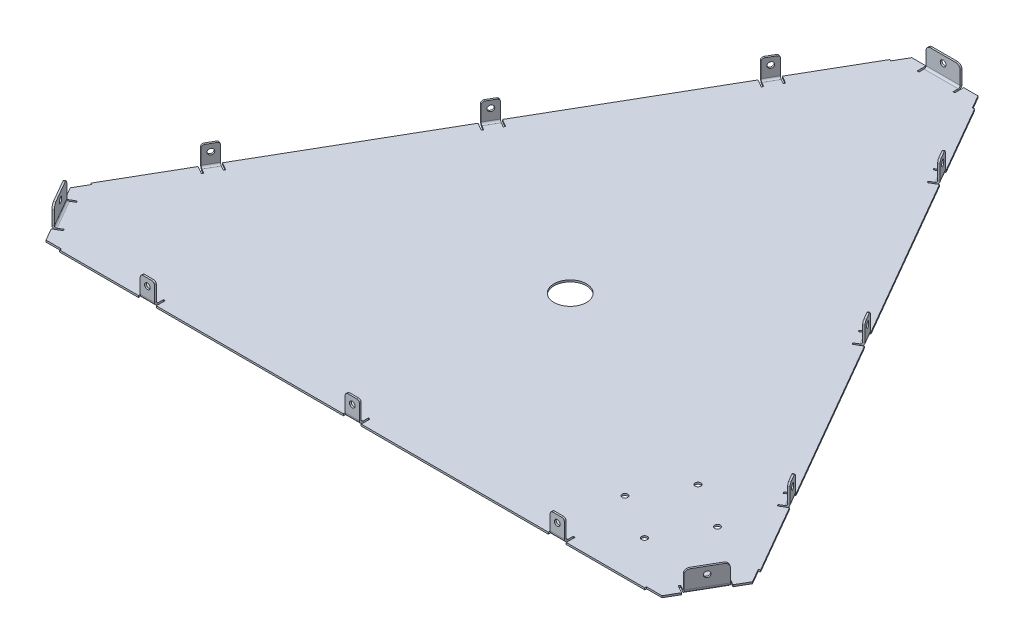
from build123d import *

# Parameters (mm, degrees)
BOSS_EXTRUDE1_DEPTH            = 1
EDGE_FLANGE1_STRIP_W           = 6.2
EDGE_FLANGE1_STRIP_H           = 1
EDGE_FLANGE1_STRIP_CUT_DEPTH   = 19.17
EDGE_FLANGE1_STRIP_2_W         = 6.2
EDGE_FLANGE1_STRIP_2_H         = 1
EDGE_FLANGE1_STRIP_CUT_2_DEPTH = 19.13
EDGE_FLANGE1_STRIP_3_W         = 6.2
EDGE_FLANGE1_STRIP_3_H         = 1
EDGE_FLANGE1_STRIP_CUT_3_DEPTH = 19.13
EDGE_FLANGE1_DEPTH             = 19.17
EDGE_FLANGE1_BEND_DEPTH        = 19.13
EDGE_FLANGE1_BEND_2_DEPTH      = 19.13
FILLET1_R                      = 2.5
EDGE_FLANGE2_STRIP_W           = 6.2
EDGE_FLANGE2_STRIP_H           = 1
EDGE_FLANGE2_STRIP_CUT_DEPTH   = 8
EDGE_FLANGE2_STRIP_2_W         = 6.2
EDGE_FLANGE2_STRIP_2_H         = 1
EDGE_FLANGE2_STRIP_CUT_2_DEPTH = 8
EDGE_FLANGE2_STRIP_3_W         = 6.2
EDGE_FLANGE2_STRIP_3_H         = 1
EDGE_FLANGE2_STRIP_CUT_3_DEPTH = 8
EDGE_FLANGE2_STRIP_4_W         = 6.2
EDGE_FLANGE2_STRIP_4_H         = 1
EDGE_FLANGE2_STRIP_CUT_4_DEPTH = 8
EDGE_FLANGE2_STRIP_5_W         = 6.2
EDGE_FLANGE2_STRIP_5_H         = 1
EDGE_FLANGE2_STRIP_CUT_5_DEPTH = 8
EDGE_FLANGE2_STRIP_6_W         = 6.2
EDGE_FLANGE2_STRIP_6_H         = 1
EDGE_FLANGE2_STRIP_CUT_6_DEPTH = 8
EDGE_FLANGE2_STRIP_7_W         = 6.2
EDGE_FLANGE2_STRIP_7_H         = 1
EDGE_FLANGE2_STRIP_CUT_7_DEPTH = 8
EDGE_FLANGE2_STRIP_8_W         = 6.2
EDGE_FLANGE2_STRIP_8_H         = 1
EDGE_FLANGE2_STRIP_CUT_8_DEPTH = 8
EDGE_FLANGE2_STRIP_9_W         = 6.2
EDGE_FLANGE2_STRIP_9_H         = 1
EDGE_FLANGE2_STRIP_CUT_9_DEPTH = 8
EDGE_FLANGE2_DEPTH             = 8
EDGE_FLANGE2_BEND_DEPTH        = 8
EDGE_FLANGE2_BEND_2_DEPTH      = 8
EDGE_FLANGE2_BEND_3_DEPTH      = 8
EDGE_FLANGE2_BEND_4_DEPTH      = 8
EDGE_FLANGE2_BEND_5_DEPTH      = 8
EDGE_FLANGE2_BEND_6_DEPTH      = 8
EDGE_FLANGE2_BEND_7_DEPTH      = 8
EDGE_FLANGE2_BEND_8_DEPTH      = 8
FILLET2_R                      = 1.5
SKETCH42_R                     = 1.6
CUT_EXTRUDE1_DEPTH             = 1
SKETCH43_R                     = 1.6
CUT_EXTRUDE2_DEPTH             = 1
SKETCH44_R                     = 1.6
CUT_EXTRUDE3_DEPTH             = 1
SKETCH45_R                     = 1.6
CUT_EXTRUDE4_DEPTH             = 10
SKETCH46_R                     = 1.6
CUT_EXTRUDE5_DEPTH             = 10
SKETCH47_R                     = 1.6
CUT_EXTRUDE6_DEPTH             = 10
SKETCH48_R                     = 1.6
SKETCH48_R_2                   = 9.1
CUT_EXTRUDE7_DEPTH             = 10


# Sheet-metal steps are written as plain solids
with BuildPart() as part:
    # Sketch1 → Boss-Extrude1 (new body)
    with BuildSketch(Plane(origin=(0, 0, 0), x_dir=(1, 0, 0), z_dir=(0, 1, 0))):
        Polygon((-2.259810517, 187.062411747), (2.090189483, 194.59683276), (10.090189483, 194.59683276), (10.090189483, 189.59683276), (11.090189483, 189.59683276), (11.090189483, 194.59683276), (30.260189483, 194.59683276), (30.260189483, 189.59683276), (31.260189483, 189.59683276), (31.260189483, 194.59683276), (39.26057424, 194.59683276), (43.61057424, 187.062411747), (44.469773433, 187.558470632), (66.511269353, 149.381479823), (62.181142334, 146.881479823), (62.681142334, 146.01545442), (67.011269353, 148.51545442), (71.011269353, 141.587251189), (66.681142334, 139.087251189), (67.181142334, 138.221225786), (71.511269353, 140.721225786), (124.011269353, 49.788558388), (119.681142334, 47.288558388), (120.181142334, 46.422532984), (124.511269353, 48.922532984), (128.511269353, 41.994329754), (124.181142334, 39.494329754), (124.681142334, 38.62830435), (129.011269353, 41.12830435), (181.511269353, -49.804363047), (177.181142334, -52.304363047), (177.681142334, -53.170388451), (182.011269353, -50.670388451), (186.011269353, -57.598591681), (181.681142334, -60.098591681), (182.181142334, -60.964617085), (186.511269353, -58.464617085), (208.601269353, -96.725619424), (207.735243949, -97.225619424), (212.085243949, -104.760040437), (208.06505157, -111.723217893), (203.734924551, -109.223217893), (203.234924551, -110.089243297), (207.56505157, -112.589243297), (198.00005157, -129.156309272), (193.669924551, -126.656309272), (193.169924551, -127.522334675), (197.50005157, -130.022334675), (193.50005157, -136.950537906), (184.80005157, -136.950537906), (184.80005157, -137.950537906), (140.721610537, -137.950537906), (140.721610537, -132.952033259), (139.721610537, -132.952033259), (139.721610537, -137.950537906), (131.721610537, -137.950537906), (131.721610537, -132.952033259), (130.721610537, -132.952033259), (130.721610537, -137.950537906), (25.721610537, -137.950537906), (25.721610537, -132.952033259), (24.721610537, -132.952033259), (24.721610537, -137.950537906), (16.721610537, -137.950537906), (16.721610537, -132.952033259), (15.721610537, -132.952033259), (15.721610537, -137.950537906), (-89.278389463, -137.950537906), (-89.278389463, -132.952033259), (-90.278389463, -132.952033259), (-90.278389463, -137.950537906), (-98.278389463, -137.950537906), (-98.278389463, -132.952033259), (-99.278389463, -132.952033259), (-99.278389463, -137.950537906), (-143.458389463, -137.950537906), (-143.458389463, -136.950537906), (-152.158389463, -136.950537906), (-156.158389463, -130.022334675), (-151.828262444, -127.522334675), (-152.328262444, -126.656309272), (-156.658389463, -129.156309272), (-166.223389463, -112.589243297), (-161.893262444, -110.089243297), (-162.393262444, -109.223217893), (-166.723389463, -111.723217893), (-170.743581841, -104.760040437), (-166.393581841, -97.225619424), (-167.259607245, -96.725619424), (-145.215835921, -58.5446875), (-140.885708902, -61.0446875), (-140.385708902, -60.178662097), (-144.715835921, -57.678662097), (-140.715835921, -50.750458866), (-136.385708902, -53.250458866), (-135.885708902, -52.384433463), (-140.215835921, -49.884433463), (-87.715835921, 41.048233935), (-83.385708902, 38.548233935), (-82.885708902, 39.414259339), (-87.215835921, 41.914259339), (-83.215835921, 48.842462569), (-78.885708902, 46.342462569), (-78.385708902, 47.208487973), (-82.715835921, 49.708487973), (-30.215835921, 140.64115537), (-25.885708902, 138.14115537), (-25.385708902, 139.007180774), (-29.715835921, 141.507180774), (-25.715835921, 148.435384004), (-21.385708902, 145.935384004), (-20.885708902, 146.801409408), (-25.215835921, 149.301409408), (-3.125835921, 187.562411747), align=None)
    extrude(amount=BOSS_EXTRUDE1_DEPTH)

    # Edge-Flange1 strip (across the edge) → Edge-Flange1 strip cut (cut)
    with BuildSketch(Plane(origin=(30.260189483, 1, -194.59683276), x_dir=(0, 0, 1), z_dir=(-1, 0, 0))):
        with Locations((-1, -0.5)):
            Rectangle(EDGE_FLANGE1_STRIP_W, EDGE_FLANGE1_STRIP_H)
    extrude(amount=EDGE_FLANGE1_STRIP_CUT_DEPTH, mode=Mode.SUBTRACT)

    # Edge-Flange1 strip 2 (across the edge) → Edge-Flange1 strip cut 2 (cut)
    with BuildSketch(Plane(origin=(198.00005157, 1, 129.156309272), x_dir=(-0.866025403784439, 3.491481338843133e-15, -0.4999999999999995), z_dir=(0.4999999999999995, 0, -0.866025403784439))):
        with Locations((-1, -0.5)):
            Rectangle(EDGE_FLANGE1_STRIP_2_W, EDGE_FLANGE1_STRIP_2_H)
    extrude(amount=EDGE_FLANGE1_STRIP_CUT_2_DEPTH, mode=Mode.SUBTRACT)

    # Edge-Flange1 strip 3 (across the edge) → Edge-Flange1 strip cut 3 (cut)
    with BuildSketch(Plane(origin=(-166.223389463, 1, 112.589243297), x_dir=(0.8660254037844379, 3.4914813388431334e-15, -0.5000000000000012), z_dir=(0.5000000000000012, 0, 0.8660254037844379))):
        with Locations((-1, -0.5)):
            Rectangle(EDGE_FLANGE1_STRIP_3_W, EDGE_FLANGE1_STRIP_3_H)
    extrude(amount=EDGE_FLANGE1_STRIP_CUT_3_DEPTH, mode=Mode.SUBTRACT)

    # Edge-Flange1 section (across the edge) → Edge-Flange1 (add)
    with BuildSketch(Plane(origin=(30.260189483, 1, -194.59683276), x_dir=(0, 0, 1), z_dir=(-1, 0, 0))):
        with BuildLine():
            Line((0, 1.1), (0, 11))
            Line((0, 11), (1, 11))
            Line((1, 11), (1, 1.1))
            ThreePointArc((1, 1.1), (1.322182541, 0.322182541), (2.1, 0))
            Line((2.1, 0), (2.1, -1))
            ThreePointArc((2.1, -1), (0.61507576, -0.38492424), (0, 1.1))
        make_face()
    extrude(amount=EDGE_FLANGE1_DEPTH)

    # Edge-Flange1 section 2 (across the edge) → Edge-Flange1 bend (add)
    with BuildSketch(Plane(origin=(198.00005157, 1, 129.156309272), x_dir=(-0.866025403784439, 3.491481338843133e-15, -0.4999999999999995), z_dir=(0.4999999999999995, 0, -0.866025403784439))):
        with BuildLine():
            Line((0, 1.1), (0, 11))
            Line((0, 11), (1, 11))
            Line((1, 11), (1, 1.1))
            ThreePointArc((1, 1.1), (1.322182541, 0.322182541), (2.1, 0))
            Line((2.1, 0), (2.1, -1))
            ThreePointArc((2.1, -1), (0.61507576, -0.38492424), (0, 1.1))
        make_face()
    extrude(amount=EDGE_FLANGE1_BEND_DEPTH)

    # Edge-Flange1 section 3 (across the edge) → Edge-Flange1 bend 2 (add)
    with BuildSketch(Plane(origin=(-166.223389463, 1, 112.589243297), x_dir=(0.8660254037844379, 3.4914813388431334e-15, -0.5000000000000012), z_dir=(0.5000000000000012, 0, 0.8660254037844379))):
        with BuildLine():
            Line((0, 1.1), (0, 11))
            Line((0, 11), (1, 11))
            Line((1, 11), (1, 1.1))
            ThreePointArc((1, 1.1), (1.322182541, 0.322182541), (2.1, 0))
            Line((2.1, 0), (2.1, -1))
            ThreePointArc((2.1, -1), (0.61507576, -0.38492424), (0, 1.1))
        make_face()
    extrude(amount=EDGE_FLANGE1_BEND_2_DEPTH)

    # Fillet1
    fillet1_edges = [part.edges().sort_by_distance(p)[0] for p in [
        (30.260189483, 12, -194.09683276),
        (11.090189483, 12, -194.09683276),
        (197.567038868, 12, 128.906309272),
        (207.132038868, 12, 112.339243297),
        (-165.790376761, 12, 112.339243297),
        (-156.225376761, 12, 128.906309272),
    ]]
    fillet(fillet1_edges, radius=FILLET1_R)

    # Edge-Flange2 strip (across the edge) → Edge-Flange2 strip cut (cut)
    with BuildSketch(Plane(origin=(-98.278389463, 1, 137.950537906), x_dir=(0, 0, -1), z_dir=(1, 0, 0))):
        with Locations((-1, -0.5)):
            Rectangle(EDGE_FLANGE2_STRIP_W, EDGE_FLANGE2_STRIP_H)
    extrude(amount=EDGE_FLANGE2_STRIP_CUT_DEPTH, mode=Mode.SUBTRACT)

    # Edge-Flange2 strip 2 (across the edge) → Edge-Flange2 strip cut 2 (cut)
    with BuildSketch(Plane(origin=(16.721610537, 1, 137.950537906), x_dir=(0, 0, -1), z_dir=(1, 0, 0))):
        with Locations((-1, -0.5)):
            Rectangle(EDGE_FLANGE2_STRIP_2_W, EDGE_FLANGE2_STRIP_2_H)
    extrude(amount=EDGE_FLANGE2_STRIP_CUT_2_DEPTH, mode=Mode.SUBTRACT)

    # Edge-Flange2 strip 3 (across the edge) → Edge-Flange2 strip cut 3 (cut)
    with BuildSketch(Plane(origin=(131.721610537, 1, 137.950537906), x_dir=(0, 0, -1), z_dir=(1, 0, 0))):
        with Locations((-1, -0.5)):
            Rectangle(EDGE_FLANGE2_STRIP_3_W, EDGE_FLANGE2_STRIP_3_H)
    extrude(amount=EDGE_FLANGE2_STRIP_CUT_3_DEPTH, mode=Mode.SUBTRACT)

    # Edge-Flange2 strip 4 (across the edge) → Edge-Flange2 strip cut 4 (cut)
    with BuildSketch(Plane(origin=(186.011269353, 1, 57.598591681), x_dir=(-0.8660254037844403, 3.4914813388431334e-15, 0.4999999999999975), z_dir=(-0.4999999999999975, 0, -0.8660254037844403))):
        with Locations((-1, -0.5)):
            Rectangle(EDGE_FLANGE2_STRIP_4_W, EDGE_FLANGE2_STRIP_4_H)
    extrude(amount=EDGE_FLANGE2_STRIP_CUT_4_DEPTH, mode=Mode.SUBTRACT)

    # Edge-Flange2 strip 5 (across the edge) → Edge-Flange2 strip cut 5 (cut)
    with BuildSketch(Plane(origin=(128.511269353, 1, -41.994329754), x_dir=(-0.8660254037844394, 3.5155183724229278e-15, 0.4999999999999987), z_dir=(-0.4999999999999987, 0, -0.8660254037844394))):
        with Locations((-1, -0.5)):
            Rectangle(EDGE_FLANGE2_STRIP_5_W, EDGE_FLANGE2_STRIP_5_H)
    extrude(amount=EDGE_FLANGE2_STRIP_CUT_5_DEPTH, mode=Mode.SUBTRACT)

    # Edge-Flange2 strip 6 (across the edge) → Edge-Flange2 strip cut 6 (cut)
    with BuildSketch(Plane(origin=(71.011269353, 1, -141.587251189), x_dir=(-0.8660254037844404, 3.4914813388431334e-15, 0.4999999999999973), z_dir=(-0.4999999999999973, 0, -0.8660254037844404))):
        with Locations((-1, -0.5)):
            Rectangle(EDGE_FLANGE2_STRIP_6_W, EDGE_FLANGE2_STRIP_6_H)
    extrude(amount=EDGE_FLANGE2_STRIP_CUT_6_DEPTH, mode=Mode.SUBTRACT)

    # Edge-Flange2 strip 7 (across the edge) → Edge-Flange2 strip cut 7 (cut)
    with BuildSketch(Plane(origin=(-25.715835921, 1, -148.435384004), x_dir=(0.8660254037844387, 3.491481338843133e-15, 0.5000000000000001), z_dir=(-0.5000000000000001, 0, 0.8660254037844387))):
        with Locations((-1, -0.5)):
            Rectangle(EDGE_FLANGE2_STRIP_7_W, EDGE_FLANGE2_STRIP_7_H)
    extrude(amount=EDGE_FLANGE2_STRIP_CUT_7_DEPTH, mode=Mode.SUBTRACT)

    # Edge-Flange2 strip 8 (across the edge) → Edge-Flange2 strip cut 8 (cut)
    with BuildSketch(Plane(origin=(-83.215835921, 1, -48.842462569), x_dir=(0.8660254037844392, 3.4914813388431334e-15, 0.4999999999999991), z_dir=(-0.4999999999999991, 0, 0.8660254037844392))):
        with Locations((-1, -0.5)):
            Rectangle(EDGE_FLANGE2_STRIP_8_W, EDGE_FLANGE2_STRIP_8_H)
    extrude(amount=EDGE_FLANGE2_STRIP_CUT_8_DEPTH, mode=Mode.SUBTRACT)

    # Edge-Flange2 strip 9 (across the edge) → Edge-Flange2 strip cut 9 (cut)
    with BuildSketch(Plane(origin=(-140.715835921, 1, 50.750458866), x_dir=(0.8660254037844387, 3.4914813388431334e-15, 0.5000000000000001), z_dir=(-0.5000000000000001, 0, 0.8660254037844387))):
        with Locations((-1, -0.5)):
            Rectangle(EDGE_FLANGE2_STRIP_9_W, EDGE_FLANGE2_STRIP_9_H)
    extrude(amount=EDGE_FLANGE2_STRIP_CUT_9_DEPTH, mode=Mode.SUBTRACT)

    # Edge-Flange2 section (across the edge) → Edge-Flange2 (add)
    with BuildSketch(Plane(origin=(-98.278389463, 1, 137.950537906), x_dir=(0, 0, -1), z_dir=(1, 0, 0))):
        with BuildLine():
            Line((0, 1.1), (0, 11))
            Line((0, 11), (1, 11))
            Line((1, 11), (1, 1.1))
            ThreePointArc((1, 1.1), (1.322182541, 0.322182541), (2.1, 0))
            Line((2.1, 0), (2.1, -1))
            ThreePointArc((2.1, -1), (0.61507576, -0.38492424), (0, 1.1))
        make_face()
    extrude(amount=EDGE_FLANGE2_DEPTH)

    # Edge-Flange2 section 2 (across the edge) → Edge-Flange2 bend (add)
    with BuildSketch(Plane(origin=(16.721610537, 1, 137.950537906), x_dir=(0, 0, -1), z_dir=(1, 0, 0))):
        with BuildLine():
            Line((0, 1.1), (0, 11))
            Line((0, 11), (1, 11))
            Line((1, 11), (1, 1.1))
            ThreePointArc((1, 1.1), (1.322182541, 0.322182541), (2.1, 0))
            Line((2.1, 0), (2.1, -1))
            ThreePointArc((2.1, -1), (0.61507576, -0.38492424), (0, 1.1))
        make_face()
    extrude(amount=EDGE_FLANGE2_BEND_DEPTH)

    # Edge-Flange2 section 3 (across the edge) → Edge-Flange2 bend 2 (add)
    with BuildSketch(Plane(origin=(131.721610537, 1, 137.950537906), x_dir=(0, 0, -1), z_dir=(1, 0, 0))):
        with BuildLine():
            Line((0, 1.1), (0, 11))
            Line((0, 11), (1, 11))
            Line((1, 11), (1, 1.1))
            ThreePointArc((1, 1.1), (1.322182541, 0.322182541), (2.1, 0))
            Line((2.1, 0), (2.1, -1))
            ThreePointArc((2.1, -1), (0.61507576, -0.38492424), (0, 1.1))
        make_face()
    extrude(amount=EDGE_FLANGE2_BEND_2_DEPTH)

    # Edge-Flange2 section 4 (across the edge) → Edge-Flange2 bend 3 (add)
    with BuildSketch(Plane(origin=(186.011269353, 1, 57.598591681), x_dir=(-0.8660254037844403, 3.4914813388431334e-15, 0.4999999999999975), z_dir=(-0.4999999999999975, 0, -0.8660254037844403))):
        with BuildLine():
            Line((0, 1.1), (0, 11))
            Line((0, 11), (1, 11))
            Line((1, 11), (1, 1.1))
            ThreePointArc((1, 1.1), (1.322182541, 0.322182541), (2.1, 0))
            Line((2.1, 0), (2.1, -1))
            ThreePointArc((2.1, -1), (0.61507576, -0.38492424), (0, 1.1))
        make_face()
    extrude(amount=EDGE_FLANGE2_BEND_3_DEPTH)

    # Edge-Flange2 section 5 (across the edge) → Edge-Flange2 bend 4 (add)
    with BuildSketch(Plane(origin=(128.511269353, 1, -41.994329754), x_dir=(-0.8660254037844394, 3.5155183724229278e-15, 0.4999999999999987), z_dir=(-0.4999999999999987, 0, -0.8660254037844394))):
        with BuildLine():
            Line((0, 1.1), (0, 11))
            Line((0, 11), (1, 11))
            Line((1, 11), (1, 1.1))
            ThreePointArc((1, 1.1), (1.322182541, 0.322182541), (2.1, 0))
            Line((2.1, 0), (2.1, -1))
            ThreePointArc((2.1, -1), (0.61507576, -0.38492424), (0, 1.1))
        make_face()
    extrude(amount=EDGE_FLANGE2_BEND_4_DEPTH)

    # Edge-Flange2 section 6 (across the edge) → Edge-Flange2 bend 5 (add)
    with BuildSketch(Plane(origin=(71.011269353, 1, -141.587251189), x_dir=(-0.8660254037844404, 3.4914813388431334e-15, 0.4999999999999973), z_dir=(-0.4999999999999973, 0, -0.8660254037844404))):
        with BuildLine():
            Line((0, 1.1), (0, 11))
            Line((0, 11), (1, 11))
            Line((1, 11), (1, 1.1))
            ThreePointArc((1, 1.1), (1.322182541, 0.322182541), (2.1, 0))
            Line((2.1, 0), (2.1, -1))
            ThreePointArc((2.1, -1), (0.61507576, -0.38492424), (0, 1.1))
        make_face()
    extrude(amount=EDGE_FLANGE2_BEND_5_DEPTH)

    # Edge-Flange2 section 7 (across the edge) → Edge-Flange2 bend 6 (add)
    with BuildSketch(Plane(origin=(-25.715835921, 1, -148.435384004), x_dir=(0.8660254037844387, 3.491481338843133e-15, 0.5000000000000001), z_dir=(-0.5000000000000001, 0, 0.8660254037844387))):
        with BuildLine():
            Line((0, 1.1), (0, 11))
            Line((0, 11), (1, 11))
            Line((1, 11), (1, 1.1))
            ThreePointArc((1, 1.1), (1.322182541, 0.322182541), (2.1, 0))
            Line((2.1, 0), (2.1, -1))
            ThreePointArc((2.1, -1), (0.61507576, -0.38492424), (0, 1.1))
        make_face()
    extrude(amount=EDGE_FLANGE2_BEND_6_DEPTH)

    # Edge-Flange2 section 8 (across the edge) → Edge-Flange2 bend 7 (add)
    with BuildSketch(Plane(origin=(-83.215835921, 1, -48.842462569), x_dir=(0.8660254037844392, 3.4914813388431334e-15, 0.4999999999999991), z_dir=(-0.4999999999999991, 0, 0.8660254037844392))):
        with BuildLine():
            Line((0, 1.1), (0, 11))
            Line((0, 11), (1, 11))
            Line((1, 11), (1, 1.1))
            ThreePointArc((1, 1.1), (1.322182541, 0.322182541), (2.1, 0))
            Line((2.1, 0), (2.1, -1))
            ThreePointArc((2.1, -1), (0.61507576, -0.38492424), (0, 1.1))
        make_face()
    extrude(amount=EDGE_FLANGE2_BEND_7_DEPTH)

    # Edge-Flange2 section 9 (across the edge) → Edge-Flange2 bend 8 (add)
    with BuildSketch(Plane(origin=(-140.715835921, 1, 50.750458866), x_dir=(0.8660254037844387, 3.4914813388431334e-15, 0.5000000000000001), z_dir=(-0.5000000000000001, 0, 0.8660254037844387))):
        with BuildLine():
            Line((0, 1.1), (0, 11))
            Line((0, 11), (1, 11))
            Line((1, 11), (1, 1.1))
            ThreePointArc((1, 1.1), (1.322182541, 0.322182541), (2.1, 0))
            Line((2.1, 0), (2.1, -1))
            ThreePointArc((2.1, -1), (0.61507576, -0.38492424), (0, 1.1))
        make_face()
    extrude(amount=EDGE_FLANGE2_BEND_8_DEPTH)

    # Fillet2
    fillet2_edges = [part.edges().sort_by_distance(p)[0] for p in [
        (-98.278389463, 12, 137.450537906),
        (-90.278389463, 12, 137.450537906),
        (16.721610537, 12, 137.450537906),
        (24.721610537, 12, 137.450537906),
        (131.721610537, 12, 137.450537906),
        (139.721610537, 12, 137.450537906),
        (185.578256651, 12, 57.848591681),
        (181.578256651, 12, 50.920388451),
        (128.078256651, 12, -41.744329754),
        (124.078256651, 12, -48.672532984),
        (70.578256651, 12, -141.337251189),
        (66.578256651, 12, -148.26545442),
        (-25.282823219, 12, -148.185384004),
        (-29.282823219, 12, -141.257180774),
        (-82.782823219, 12, -48.592462569),
        (-86.782823219, 12, -41.664259339),
        (-140.282823219, 12, 51.000458866),
        (-144.282823219, 12, 57.928662097),
    ]]
    fillet(fillet2_edges, radius=FILLET2_R)

    # Sketch42 → Cut-Extrude1 (cut)
    with BuildSketch(Plane(origin=(-83.561283625, 0, -48.244129595), x_dir=(-0.4999999999999998, -2.2078298785159348e-15, 0.8660254037844388), z_dir=(-0.8660254037844388, -3.824073524058226e-15, -0.4999999999999998))):
        with Locations((-111.690895407, 8)):
            Circle(SKETCH42_R)
        with Locations((3.309104593, 8)):
            Circle(SKETCH42_R)
        with Locations((118.309104593, 8)):
            Circle(SKETCH42_R)
    extrude(amount=-CUT_EXTRUDE1_DEPTH, mode=Mode.SUBTRACT)

    # Sketch43 → Cut-Extrude2 (cut)
    with BuildSketch(Plane.XY.offset(137.950537906)):
        with Locations((-94.278389463, 8)):
            Circle(SKETCH43_R)
        with Locations((20.721610537, 8)):
            Circle(SKETCH43_R)
        with Locations((135.721610537, 8)):
            Circle(SKETCH43_R)
    extrude(amount=-CUT_EXTRUDE2_DEPTH, mode=Mode.SUBTRACT)

    # Sketch44 → Cut-Extrude3 (cut)
    with BuildSketch(Plane(origin=(114.567530206, 0, -66.145594405), x_dir=(-0.4999999999999941, 0, -0.866025403784442), z_dir=(0.8660254037844421, 0, -0.49999999999999417))):
        with Locations((-138.887478295, 8)):
            Circle(SKETCH44_R)
        with Locations((-23.887478295, 8)):
            Circle(SKETCH44_R)
        with Locations((91.112521705, 8)):
            Circle(SKETCH44_R)
    extrude(amount=-CUT_EXTRUDE3_DEPTH, mode=Mode.SUBTRACT)

    # Sketch45 → Cut-Extrude4 (cut)
    with BuildSketch(Plane(origin=(204.426361122, 0, 118.025614623), x_dir=(0.5000000000000004, -1.2616170734376786e-15, -0.8660254037844384), z_dir=(0.8660254037844384, -2.1851848708904134e-15, 0.5000000000000004))):
        with Locations((-3.287619103, 8)):
            Circle(SKETCH45_R)
    extrude(amount=-CUT_EXTRUDE4_DEPTH, mode=Mode.SUBTRACT)

    # Sketch46 → Cut-Extrude5 (cut)
    with BuildSketch(Plane(origin=(0, 0, -194.59683276), x_dir=(-1, 0, 0), z_dir=(0, 0, -1))):
        with Locations(Location((-20.675189483, 8, 0), (0, 0, 90))):
            Circle(SKETCH46_R)
    extrude(amount=-CUT_EXTRUDE5_DEPTH, mode=Mode.SUBTRACT)

    # Sketch47 → Cut-Extrude6 (cut)
    with BuildSketch(Plane(origin=(-173.420114541, 0, 100.124149813), x_dir=(0.5000000000000012, 1.990012030401156e-15, 0.866025403784438), z_dir=(-0.866025403784438, -3.4468019443280924e-15, 0.5000000000000012))):
        with Locations((23.958450157, 8)):
            Circle(SKETCH47_R)
    extrude(amount=-CUT_EXTRUDE6_DEPTH, mode=Mode.SUBTRACT)

    # Sketch48 → Cut-Extrude7 (cut)
    with BuildSketch(Plane.XZ):
        with Locations(Location((134.546259377, 98.801427476, 0), (0, 0, 270))):
            Circle(SKETCH48_R)
        with Locations(Location((160.528002987, 113.799727345, 0), (0, 0, 270))):
            Circle(SKETCH48_R)
        with Locations(Location((175.526302856, 87.817983735, 0), (0, 0, 270))):
            Circle(SKETCH48_R)
        with Locations(Location((149.544559246, 72.819683866, 0), (0, 0, 270))):
            Circle(SKETCH48_R)
        with Locations(Location((20.704618118, 15.659040826, 0), (0, 0, 270))):
            Circle(SKETCH48_R_2)
    extrude(amount=-CUT_EXTRUDE7_DEPTH, mode=Mode.SUBTRACT)


solid = part.part
